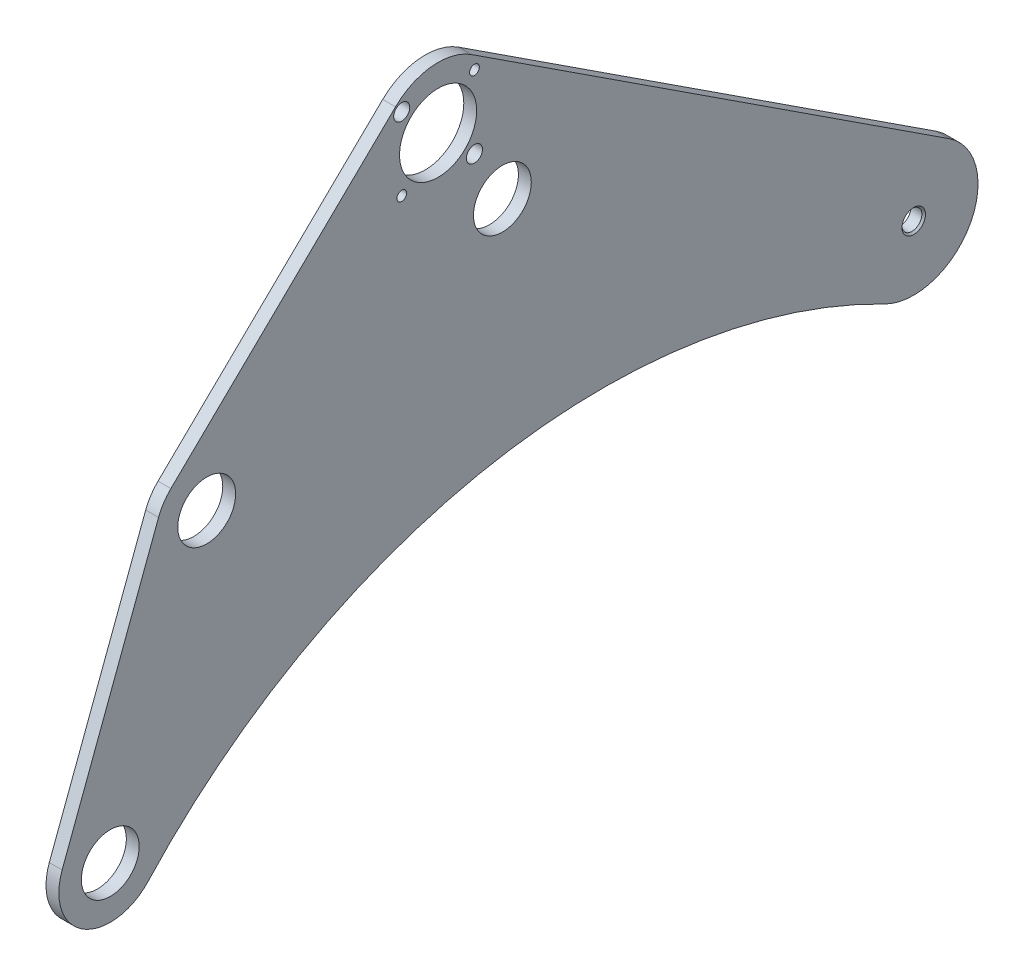
from build123d import *

# Parameters (mm, degrees)
BOSS_EXTRUDE1_DEPTH               = 6.35
CUT_EXTRUDE1_REACH                = 463.209
SKETCH3_R                         = 14.2875
SKETCH3_R_2                       = 19.05
SKETCH3_R_3                       = 2.413
SKETCH3_R_4                       = 3.96875
F_3_8_CLEARANCE_HOLE2_D           = 9.8044
F_3_8_CLEARANCE_HOLE2_CSINK_D     = 11.58748
F_3_8_CLEARANCE_HOLE2_CSINK_ANGLE = 90


with BuildPart() as part:
    # Sketch2 → Boss-Extrude1 (new body)
    with BuildSketch(Plane(origin=(0, 0, 0), x_dir=(0, 0, -1), z_dir=(1, 0, 0))):
        with BuildLine():
            Line((-420.65776111, -67.281464584), (-373.03276111, 59.718535416))
            ThreePointArc((-373.03276111, 59.718535416), (-370.505449055, 64.705606261), (-366.948304567, 69.018946606))
            Line((-366.948304567, 69.018946606), (-255.966736674, 176.828999095))
            ThreePointArc((-255.966736674, 176.828999095), (-237.853043868, 185.216470627), (-218.467902472, 180.454975186))
            Line((-218.467902472, 180.454975186), (17.349576345, 26.590500195))
            ThreePointArc((17.349576345, 26.590500195), (27.457947121, -15.941255906), (-14.489671706, -28.250874568))
            ThreePointArc((-14.489671706, -28.250874568), (-207.31672278, 0.568286884), (-378.160809237, -93.373790032))
            ThreePointArc((-378.160809237, -93.373790032), (-410.165032474, -97.845670164), (-420.65776111, -67.281464584))
        make_face()
    extrude(amount=BOSS_EXTRUDE1_DEPTH)

    # Sketch3 → Cut-Extrude1 (cut, up to next)
    with BuildSketch(Plane(origin=(6.35, 0, 0), x_dir=(0, 0, -1), z_dir=(1, 0, 0)), mode=Mode.PRIVATE) as cut_extrude1_sk1:
        with Locations((-203.2, 111.125)):
            Circle(SKETCH3_R)
    cut_extrude1_tool1 = extrude(cut_extrude1_sk1.sketch, amount=-CUT_EXTRUDE1_REACH, mode=Mode.PRIVATE) & part.part
    # Sketch3 → Cut-Extrude1 (cut, up to next)
    with BuildSketch(Plane(origin=(6.35, 0, 0), x_dir=(0, 0, -1), z_dir=(1, 0, 0)), mode=Mode.PRIVATE) as cut_extrude1_sk2:
        with Locations((-349.25, 50.8)):
            Circle(SKETCH3_R)
    cut_extrude1_tool2 = extrude(cut_extrude1_sk2.sketch, amount=-CUT_EXTRUDE1_REACH, mode=Mode.PRIVATE) & part.part
    # Sketch3 → Cut-Extrude1 (cut, up to next)
    with BuildSketch(Plane(origin=(6.35, 0, 0), x_dir=(0, 0, -1), z_dir=(1, 0, 0)), mode=Mode.PRIVATE) as cut_extrude1_sk3:
        with Locations((-396.875, -76.2)):
            Circle(SKETCH3_R)
    cut_extrude1_tool3 = extrude(cut_extrude1_sk3.sketch, amount=-CUT_EXTRUDE1_REACH, mode=Mode.PRIVATE) & part.part
    # Sketch3 → Cut-Extrude1 (cut, up to next)
    with BuildSketch(Plane(origin=(6.35, 0, 0), x_dir=(0, 0, -1), z_dir=(1, 0, 0)), mode=Mode.PRIVATE) as cut_extrude1_sk4:
        with Locations((-234.95, 155.194)):
            Circle(SKETCH3_R_2)
    cut_extrude1_tool4 = extrude(cut_extrude1_sk4.sketch, amount=-CUT_EXTRUDE1_REACH, mode=Mode.PRIVATE) & part.part
    # Sketch3 → Cut-Extrude1 (cut, up to next)
    with BuildSketch(Plane(origin=(6.35, 0, 0), x_dir=(0, 0, -1), z_dir=(1, 0, 0)), mode=Mode.PRIVATE) as cut_extrude1_sk5:
        with Locations((-252.910512242, 137.233487758)):
            Circle(SKETCH3_R_3)
    cut_extrude1_tool5 = extrude(cut_extrude1_sk5.sketch, amount=-CUT_EXTRUDE1_REACH, mode=Mode.PRIVATE) & part.part
    # Sketch3 → Cut-Extrude1 (cut, up to next)
    with BuildSketch(Plane(origin=(6.35, 0, 0), x_dir=(0, 0, -1), z_dir=(1, 0, 0)), mode=Mode.PRIVATE) as cut_extrude1_sk6:
        with Locations((-216.989487758, 137.233487758)):
            Circle(SKETCH3_R_4)
    cut_extrude1_tool6 = extrude(cut_extrude1_sk6.sketch, amount=-CUT_EXTRUDE1_REACH, mode=Mode.PRIVATE) & part.part
    # Sketch3 → Cut-Extrude1 (cut, up to next)
    with BuildSketch(Plane(origin=(6.35, 0, 0), x_dir=(0, 0, -1), z_dir=(1, 0, 0)), mode=Mode.PRIVATE) as cut_extrude1_sk7:
        with Locations((-216.989487758, 173.154512242)):
            Circle(SKETCH3_R_3)
    cut_extrude1_tool7 = extrude(cut_extrude1_sk7.sketch, amount=-CUT_EXTRUDE1_REACH, mode=Mode.PRIVATE) & part.part
    # Sketch3 → Cut-Extrude1 (cut, up to next)
    with BuildSketch(Plane(origin=(6.35, 0, 0), x_dir=(0, 0, -1), z_dir=(1, 0, 0)), mode=Mode.PRIVATE) as cut_extrude1_sk8:
        with Locations((-252.910512242, 173.154512242)):
            Circle(SKETCH3_R_4)
    cut_extrude1_tool8 = extrude(cut_extrude1_sk8.sketch, amount=-CUT_EXTRUDE1_REACH, mode=Mode.PRIVATE) & part.part
    add(cut_extrude1_tool1.solids().sort_by_distance((6.35, 111.125, 203.2))[0], mode=Mode.SUBTRACT)
    add(cut_extrude1_tool2.solids().sort_by_distance((6.35, 50.8, 349.25))[0], mode=Mode.SUBTRACT)
    add(cut_extrude1_tool3.solids().sort_by_distance((6.35, -76.2, 396.875))[0], mode=Mode.SUBTRACT)
    add(cut_extrude1_tool4.solids().sort_by_distance((6.35, 155.194, 234.95))[0], mode=Mode.SUBTRACT)
    add(cut_extrude1_tool5.solids().sort_by_distance((6.35, 137.233488, 252.910512))[0], mode=Mode.SUBTRACT)
    add(cut_extrude1_tool6.solids().sort_by_distance((6.35, 137.233488, 216.989488))[0], mode=Mode.SUBTRACT)
    add(cut_extrude1_tool7.solids().sort_by_distance((6.35, 173.154512, 216.989488))[0], mode=Mode.SUBTRACT)
    add(cut_extrude1_tool8.solids().sort_by_distance((6.35, 173.154512, 252.910512))[0], mode=Mode.SUBTRACT)

    # 3/8 Clearance Hole2 (through all)
    with Locations(Plane(origin=(6.35, 0, 0), x_dir=(0, 0, -1), z_dir=(1, 0, 0))):
        with Locations((0, 0)):
            CounterSinkHole(F_3_8_CLEARANCE_HOLE2_D / 2, F_3_8_CLEARANCE_HOLE2_CSINK_D / 2, counter_sink_angle=F_3_8_CLEARANCE_HOLE2_CSINK_ANGLE)


solid = part.part
